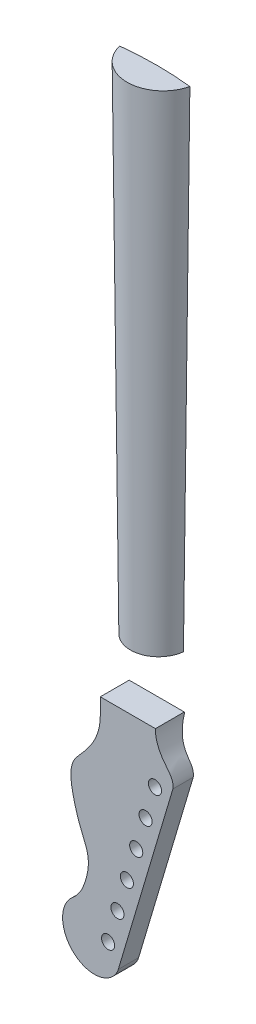
from build123d import *

# Parameters (mm, degrees)
SKETCH7_R               = 5
BOSS_EXTRUDE1_DEPTH     = 22
CUT_EXTRUDE1_DEPTH      = 89
CUT_EXTRUDE1_DEPTH_BACK = 47
FILLET1_R               = 35
FILLET2_START           = 6
FILLET2_DEPTH           = 17


with BuildPart() as part:
    # Sketch4 for Loft1 → Loft1 section 0
    with BuildSketch(Plane(origin=(0, 413.03, 0), x_dir=(1, 0, 0), z_dir=(0, 1, 0))):
        with BuildLine():
            # circular arc as an exact rational Bezier (weights 1, cos(half-angle), 1)
            Bezier((3.411173818, -1.486067363), (30.150054, 1.495276154), (56.888934182, -1.486067363), weights=[1, 0.993841412, 1])
            Bezier((56.888934182, -1.486067363), (30.150054, -113.662589607), (3.411173818, -1.486067363), weights=[1, 0.231868224, 1])
        make_face()
    # Sketch2 for Loft1 → Loft1 section 1
    with BuildSketch(Plane(origin=(0, 37.07, 0), x_dir=(1, 0, 0), z_dir=(0, 1, 0))):
        with BuildLine():
            Bezier((51.441561571, -0.941181345), (30.150054, 0.944866761), (8.858546429, -0.941181345), weights=[1, 0.996099539, 1])
            Bezier((8.858546429, -0.941181345), (30.150054, -192.779980086), (51.441561571, -0.941181345), weights=[1, 0.110309138, 1])
        make_face()
    loft()


with BuildPart() as body_2:
    # Sketch7 → Boss-Extrude1 (new body)
    with BuildSketch(Plane.XY):
        with BuildLine():
            Line((61.822469128, -45.279185569), (26.122769128, -165.279185569))
            Line((26.122769128, -165.279185569), (22.169953883, -178.566071157))
            add(Edge.make_bspline(
                [(-12.150661674, -146.419210188), (-31.612509099, -163.079183622), (-11.324326994, -182.08237919), (8.963855111, -201.085574758), (22.169953883, -178.566071157)],
                knots=[3.317459121, 3.317459121, 3.317459121, 5.043045062, 5.043045062, 6.768631003, 6.768631003, 6.768631003], degree=2, weights=[1, 0.650318294, 1, 0.650318294, 1]))
            ThreePointArc((-12.150661674, -146.419210188), (-8.791094197, -143.046061953), (-6.007432727, -139.183931522))
            add(Edge.make_bspline(
                [(9.14908, -15.846186083), (9.141550363, -28.501152073), (1.420403196, -41.2547005), (-15.149336893, -58.17130706), (-12.026921138, -78.76359191), (-6.30179243, -97.365876925), (3.428380257, -117.152927923), (-3.255551817, -134.645669988), (-6.007432727, -139.183931522)],
                knots=[0, 0, 0, 0, 0.241122102, 0.315889977, 0.476811467, 0.625347755, 0.735303781, 0.929974714, 0.929974714, 0.929974714, 0.929974714], degree=3))
            Line((9.14908, -15.846186083), (9.14908, -3.25))
            Line((9.14908, -3.25), (51.151028, -3.25))
            add(Edge.make_bspline(
                [(51.151028, -3.25), (50.937550111, -10.767323465), (56.483762161, -22.000731952), (65.296265302, -30.566236086), (64.46789676, -36.386917125)],
                knots=[0, 0, 0, 0, 0.598162067, 1, 1, 1, 1], degree=3))
            Line((64.46789676, -36.386917125), (61.822469128, -45.279185569))
        make_face()
        with Locations((50.799904, -42)):
            Circle(SKETCH7_R, mode=Mode.SUBTRACT)
        with Locations((43.659964, -66)):
            Circle(SKETCH7_R, mode=Mode.SUBTRACT)
        with Locations((36.520024, -90)):
            Circle(SKETCH7_R, mode=Mode.SUBTRACT)
        with Locations((29.380084, -114)):
            Circle(SKETCH7_R, mode=Mode.SUBTRACT)
        with Locations((22.240144, -138)):
            Circle(SKETCH7_R, mode=Mode.SUBTRACT)
        with Locations((15.100204, -162)):
            Circle(SKETCH7_R, mode=Mode.SUBTRACT)
    extrude(amount=BOSS_EXTRUDE1_DEPTH)

    # Sketch9 → Cut-Extrude1 (cut, two sides: drawn at the far end of the back side and taken through both)
    with BuildSketch(Plane(origin=(0, 0, 0), x_dir=(0, 0, -1), z_dir=(1, 0, 0)).offset(-CUT_EXTRUDE1_DEPTH_BACK)):
        Polygon((0, -4.75), (0, -188.619559547), (-6.5, -188.619559547), (-6.5, -21.683078921), align=None)
    extrude(amount=CUT_EXTRUDE1_DEPTH + CUT_EXTRUDE1_DEPTH_BACK, mode=Mode.SUBTRACT)

    # Fillet1
    fillet1_edges = [body_2.edges().sort_by_distance(p)[0] for p in [
        (33.140560044, -21.683078921, 6.5),
    ]]
    fillet(fillet1_edges, radius=FILLET1_R)

    # Fillet2: read off the stored shape, not the designer's step
    # Fillet2 outline → Fillet2 (cut)
    with BuildSketch(Plane.XY.offset(FILLET2_START)):
        with BuildLine():
            Line((22.169953883, -178.566071157), (22.850975257, -176.276904444))
            ThreePointArc((22.850975257, -176.276904444), (21.491301478, -179.452388519), (19.441266868, -182.232634909))
            add(Edge.make_bspline(
                [(19.441266868, -182.232634909), (20.998606375, -180.56349408), (22.169953883, -178.566071157)],
                knots=[6.54399072, 6.54399072, 6.54399072, 6.768631003, 6.768631003, 6.768631003], degree=2, weights=[0.920807815, 0.954477725, 1]))
        make_face()
    extrude(amount=FILLET2_DEPTH, mode=Mode.SUBTRACT)


solid = Compound([part.part, body_2.part])
